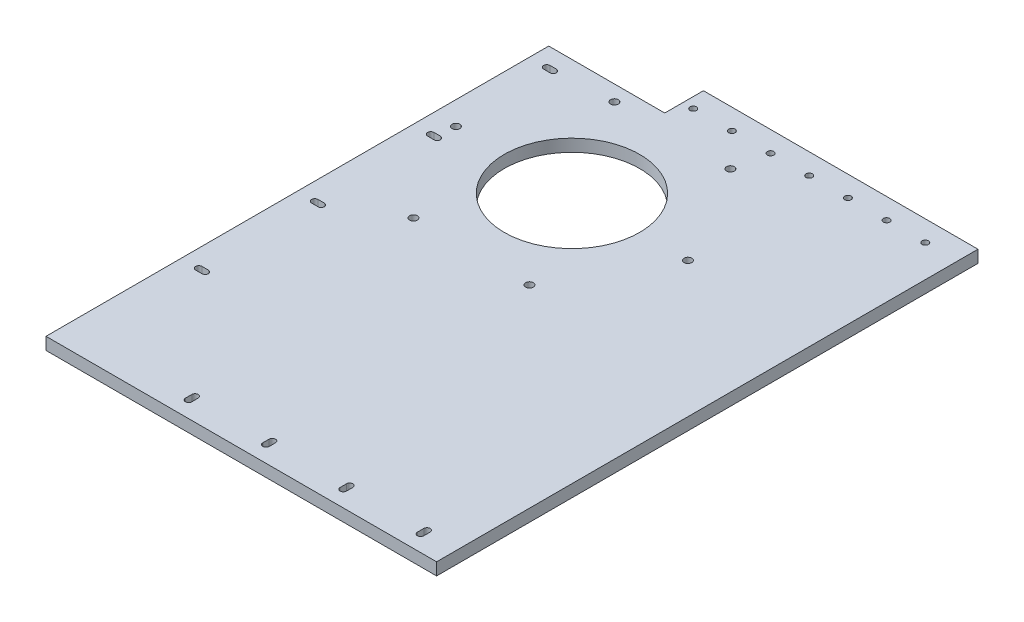
from build123d import *

# Parameters (mm, degrees)
BOSS_EXTRUDE1_DEPTH = 6.35
SKETCH9_R           = 1.65
CUT_EXTRUDE10_DEPTH = 30
CUT_EXTRUDE12_DEPTH = 30
CUT_EXTRUDE13_DEPTH = 10
SKETCH12_R          = 35
CUT_EXTRUDE14_DEPTH = 192.836707905
SKETCH13_R          = 2
CUT_EXTRUDE15_DEPTH = 192.836707905


with BuildPart() as part:
    # Sketch1 → Boss-Extrude1 (new body)
    with BuildSketch(Plane(origin=(0, 0, 0), x_dir=(1, 0, 0), z_dir=(0, 1, 0))):
        Polygon((-71, 140), (71, 140), (71, -140), (-131, -140), (-131, 120), (-71, 120), align=None)
    extrude(amount=BOSS_EXTRUDE1_DEPTH)

    # Sketch9 → Cut-Extrude10 (cut)
    with BuildSketch(Plane(origin=(0, 0, 0), x_dir=(-1, 0, 0), z_dir=(0, -1, 0))):
        with Locations((45.6, 129.325)):
            Circle(SKETCH9_R)
        with Locations((5.6, 129.325)):
            Circle(SKETCH9_R)
        with Locations((-34.4, 129.325)):
            Circle(SKETCH9_R)
        with Locations((65.6, 129.325)):
            Circle(SKETCH9_R)
        with Locations((25.6, 129.325)):
            Circle(SKETCH9_R)
        with Locations((-14.4, 129.325)):
            Circle(SKETCH9_R)
        with Locations((-54.4, 129.325)):
            Circle(SKETCH9_R)
    extrude(amount=-CUT_EXTRUDE10_DEPTH, mode=Mode.SUBTRACT)

    # Sketch11 → Cut-Extrude12 (cut)
    with BuildSketch(Plane(origin=(0, 6.35, 0), x_dir=(1, 0, 0), z_dir=(0, 1, 0))):
        with BuildLine():
            Line((-63.95, -128.355), (-63.95, -131.655))
            ThreePointArc((-63.95, -131.655), (-65.6, -133.305), (-67.25, -131.655))
            Line((-67.25, -131.655), (-67.25, -128.355))
            ThreePointArc((-67.25, -128.355), (-65.6, -126.705), (-63.95, -128.355))
        make_face()
        with BuildLine():
            Line((-23.95, -128.353535871), (-23.95, -131.653535871))
            ThreePointArc((-23.95, -131.653535871), (-25.6, -133.303535871), (-27.25, -131.653535871))
            Line((-27.25, -131.653535871), (-27.25, -128.353535871))
            ThreePointArc((-27.25, -128.353535871), (-25.6, -126.703535871), (-23.95, -128.353535871))
        make_face()
        with BuildLine():
            Line((16.05, -128.352071742), (16.05, -131.652071742))
            ThreePointArc((16.05, -131.652071742), (14.4, -133.302071742), (12.75, -131.652071742))
            Line((12.75, -131.652071742), (12.75, -128.352071742))
            ThreePointArc((12.75, -128.352071742), (14.4, -126.702071742), (16.05, -128.352071742))
        make_face()
        with BuildLine():
            Line((56.05, -128.350607613), (56.05, -131.650607613))
            ThreePointArc((56.05, -131.650607613), (54.4, -133.300607613), (52.75, -131.650607613))
            Line((52.75, -131.650607613), (52.75, -128.350607613))
            ThreePointArc((52.75, -128.350607613), (54.4, -126.700607613), (56.05, -128.350607613))
        make_face()
    extrude(amount=-CUT_EXTRUDE12_DEPTH, mode=Mode.SUBTRACT)

    # Sketch10 → Cut-Extrude13 (cut)
    with BuildSketch(Plane.XZ):
        with BuildLine():
            ThreePointArc((-121.975, 11.65), (-123.625, 10), (-121.975, 8.35))
            Line((-121.975, 8.35), (-118.675, 8.35))
            ThreePointArc((-118.675, 8.35), (-117.025, 10), (-118.675, 11.65))
            Line((-118.675, 11.65), (-121.975, 11.65))
        make_face()
        with BuildLine():
            ThreePointArc((-121.975, 71.65), (-123.625, 70), (-121.975, 68.35))
            Line((-121.975, 68.35), (-118.675, 68.35))
            ThreePointArc((-118.675, 68.35), (-117.025, 70), (-118.675, 71.65))
            Line((-118.675, 71.65), (-121.975, 71.65))
        make_face()
        with BuildLine():
            ThreePointArc((-121.975, -48.35), (-123.625, -50), (-121.975, -51.65))
            Line((-121.975, -51.65), (-118.675, -51.65))
            ThreePointArc((-118.675, -51.65), (-117.025, -50), (-118.675, -48.35))
            Line((-118.675, -48.35), (-121.975, -48.35))
        make_face()
        with BuildLine():
            ThreePointArc((-121.975, -108.35), (-123.625, -110), (-121.975, -111.65))
            Line((-121.975, -111.65), (-118.675, -111.65))
            ThreePointArc((-118.675, -111.65), (-117.025, -110), (-118.675, -108.35))
            Line((-118.675, -108.35), (-121.975, -108.35))
        make_face()
    extrude(amount=-CUT_EXTRUDE13_DEPTH, mode=Mode.SUBTRACT)

    # Sketch12 → Cut-Extrude14 (cut, through all)
    with BuildSketch(Plane(origin=(0, 6.35, 0), x_dir=(1, 0, 0), z_dir=(0, 1, 0))):
        with Locations((-59, 60)):
            Circle(SKETCH12_R)
    extrude(amount=-CUT_EXTRUDE14_DEPTH, mode=Mode.SUBTRACT)

    # Sketch13 → Cut-Extrude15 (cut, through all)
    with BuildSketch(Plane(origin=(0, 6.35, 0), x_dir=(1, 0, 0), z_dir=(0, 1, 0))):
        with Locations((-119, 60)):
            Circle(SKETCH13_R)
        with Locations((-89, 111.961524227)):
            Circle(SKETCH13_R)
        with Locations((-29, 111.961524227)):
            Circle(SKETCH13_R)
        with Locations((1, 60)):
            Circle(SKETCH13_R)
        with Locations((-29, 8.038475773)):
            Circle(SKETCH13_R)
        with Locations((-89, 8.038475773)):
            Circle(SKETCH13_R)
    extrude(amount=-CUT_EXTRUDE15_DEPTH, mode=Mode.SUBTRACT)


solid = part.part
